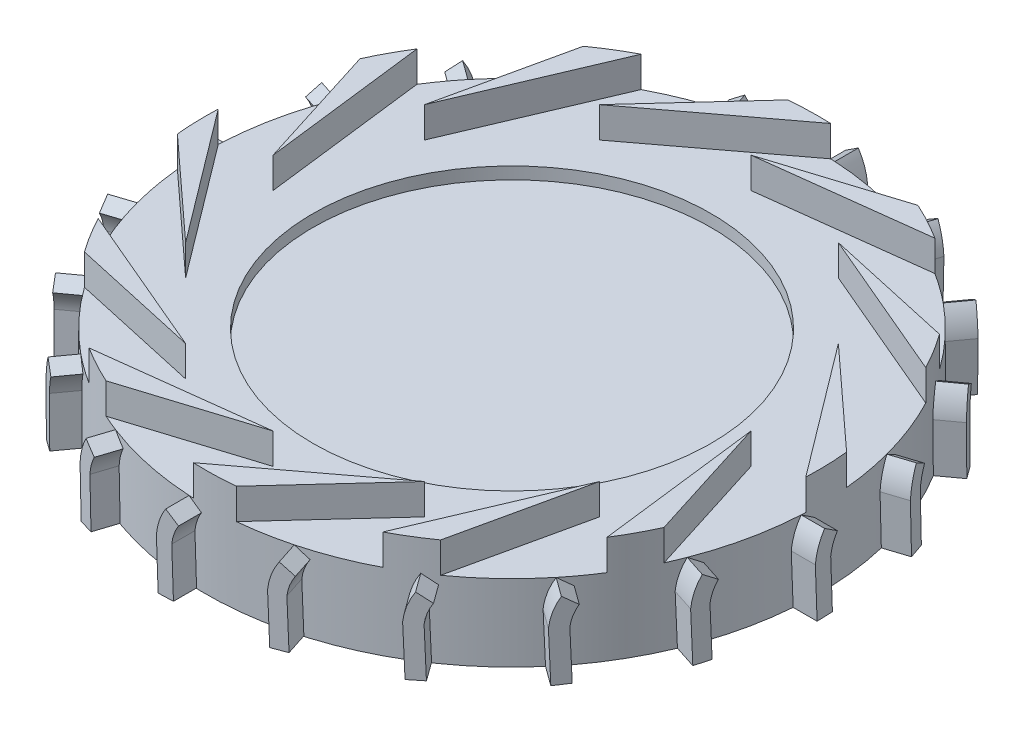
from build123d import *
from build123d.topology import SkipClean

# Parameters (mm, degrees)
BOSS_EXTRUDE1_START = 5.08
BOSS_EXTRUDE1_DEPTH = 5.08
CIRPATTERN1_COUNT   = 12
BOSS_EXTRUDE2_START = -0.254
BOSS_EXTRUDE2_DEPTH = 5.334
CIRPATTERN16_COUNT  = 20


with BuildPart() as part:
    # Sketch1 → Revolve1 (revolve)
    with BuildSketch(Plane(origin=(0, 0, 0), x_dir=(0, 0, -1), z_dir=(1, 0, 0))):
        Polygon((0, -3.548543689), (-50.8, -3.548543689), (-50.8, 9.151456311), (-33.000061, 9.151456311), (-33.000061, 7.151456311), (0, 7.151456311), align=None)
    revolve(axis=Axis((0, 26.263106796, 0), (0, -1, 0)))

    # Sketch2 → Boss-Extrude1 (add)
    with BuildSketch(Plane(origin=(0, 9.151456311, 0), x_dir=(1, 0, 0), z_dir=(0, 1, 0)).offset(BOSS_EXTRUDE1_START)):
        with BuildLine():
            Line((0, 39.6000732), (21.045325156, 46.235638733))
            ThreePointArc((21.045325156, 46.235638733), (24.162882711, 44.685513302), (27.166939829, 42.925486373))
            Line((27.166939829, 42.925486373), (0, 39.6000732))
        make_face()
    boss_extrude1 = extrude(amount=-BOSS_EXTRUDE1_DEPTH)

    # CirPattern1: Boss-Extrude1 ×12 about axis
    cirpattern1_axis = Axis((0, 9.151456311, 0), (0, 1, 0))
    for i in range(1, CIRPATTERN1_COUNT):
        add(boss_extrude1.rotate(cirpattern1_axis, i * 360 / CIRPATTERN1_COUNT))

    # Sketch3 → Boss-Extrude2 (add)
    with BuildSketch(Plane.XY.offset(49.53).offset(BOSS_EXTRUDE2_START)):
        with BuildLine():
            Line((-4.328705217, 4.692283102), (-4.041659639, -3.548543689))
            Line((-4.041659639, -3.548543689), (-1.503199101, -3.460123693))
            Line((-1.503199101, -3.460123693), (-1.784517886, 4.616291902))
            ThreePointArc((-1.784517886, 4.616291902), (-1.411995778, 6.256788328), (-0.665903927, 7.764550974))
            Line((-0.665903927, 7.764550974), (-2.793835689, 9.151456311))
            ThreePointArc((-2.793835689, 9.151456311), (-3.837025606, 7.016785997), (-4.328705217, 4.692283102))
        make_face()
    boss_extrude2 = extrude(amount=BOSS_EXTRUDE2_DEPTH)

    # CirPattern16: Boss-Extrude2 ×20 about axis
    with SkipClean():  # the faces are left unmerged after this step: merging them gives an invalid solid
        cirpattern16_axis = Axis((0, -3.548543689, 0), (0, 1, 0))
        for i in range(1, CIRPATTERN16_COUNT):
            add(boss_extrude2.rotate(cirpattern16_axis, i * 360 / CIRPATTERN16_COUNT))


solid = part.part
